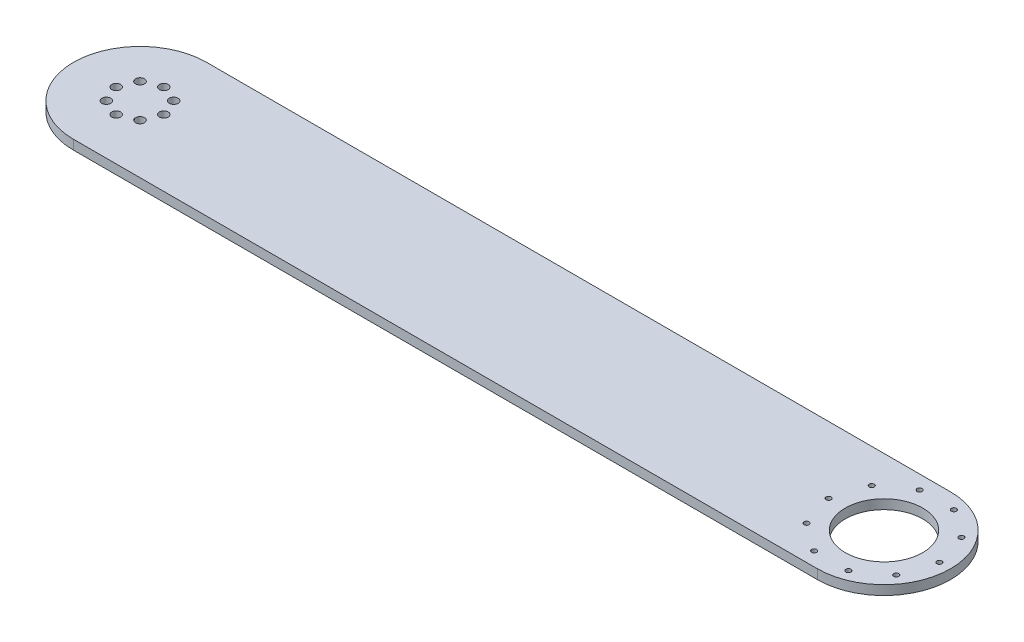
from build123d import *

# Parameters (mm, degrees)
SKETCH1_R           = 3
SKETCH1_R_2         = 1.7
SKETCH1_R_3         = 26
BOSS_EXTRUDE1_DEPTH = 6.35


with BuildPart() as part:
    # Sketch1 → Boss-Extrude1 (new body)
    with BuildSketch(Plane(origin=(0, 0, 0), x_dir=(1, 0, 0), z_dir=(0, 1, 0))):
        with BuildLine():
            Line((500, 44.75), (0, 44.75))
            ThreePointArc((0, 44.75), (-44.75, 0), (0, -44.75))
            Line((0, -44.75), (500, -44.75))
            ThreePointArc((500, -44.75), (544.75, 0), (500, 44.75))
        make_face()
        with Locations((-11.313708499, -11.313708499)):
            Circle(SKETCH1_R, mode=Mode.SUBTRACT)
        with Locations((0, -16)):
            Circle(SKETCH1_R, mode=Mode.SUBTRACT)
        with Locations((11.313708499, -11.313708499)):
            Circle(SKETCH1_R, mode=Mode.SUBTRACT)
        with Locations((16, 0)):
            Circle(SKETCH1_R, mode=Mode.SUBTRACT)
        with Locations((488.48911696, -35.426855232)):
            Circle(SKETCH1_R_2, mode=Mode.SUBTRACT)
        with Locations((511.51088304, -35.426855232)):
            Circle(SKETCH1_R_2, mode=Mode.SUBTRACT)
        with Locations((469.86411696, -21.895000648)):
            Circle(SKETCH1_R_2, mode=Mode.SUBTRACT)
        with Locations((530.13588304, -21.895000648)):
            Circle(SKETCH1_R_2, mode=Mode.SUBTRACT)
        with Locations((462.75, 0)):
            Circle(SKETCH1_R_2, mode=Mode.SUBTRACT)
        with Locations((-16, 0)):
            Circle(SKETCH1_R, mode=Mode.SUBTRACT)
        with Locations((-11.313708499, 11.313708499)):
            Circle(SKETCH1_R, mode=Mode.SUBTRACT)
        with Locations((11.313708499, 11.313708499)):
            Circle(SKETCH1_R, mode=Mode.SUBTRACT)
        with Locations((0, 16)):
            Circle(SKETCH1_R, mode=Mode.SUBTRACT)
        with Locations((500, 0)):
            Circle(SKETCH1_R_3, mode=Mode.SUBTRACT)
        with Locations((537.25, 0)):
            Circle(SKETCH1_R_2, mode=Mode.SUBTRACT)
        with Locations((469.86411696, 21.895000648)):
            Circle(SKETCH1_R_2, mode=Mode.SUBTRACT)
        with Locations((530.13588304, 21.895000648)):
            Circle(SKETCH1_R_2, mode=Mode.SUBTRACT)
        with Locations((488.48911696, 35.426855232)):
            Circle(SKETCH1_R_2, mode=Mode.SUBTRACT)
        with Locations((511.51088304, 35.426855232)):
            Circle(SKETCH1_R_2, mode=Mode.SUBTRACT)
    extrude(amount=BOSS_EXTRUDE1_DEPTH)


solid = part.part
